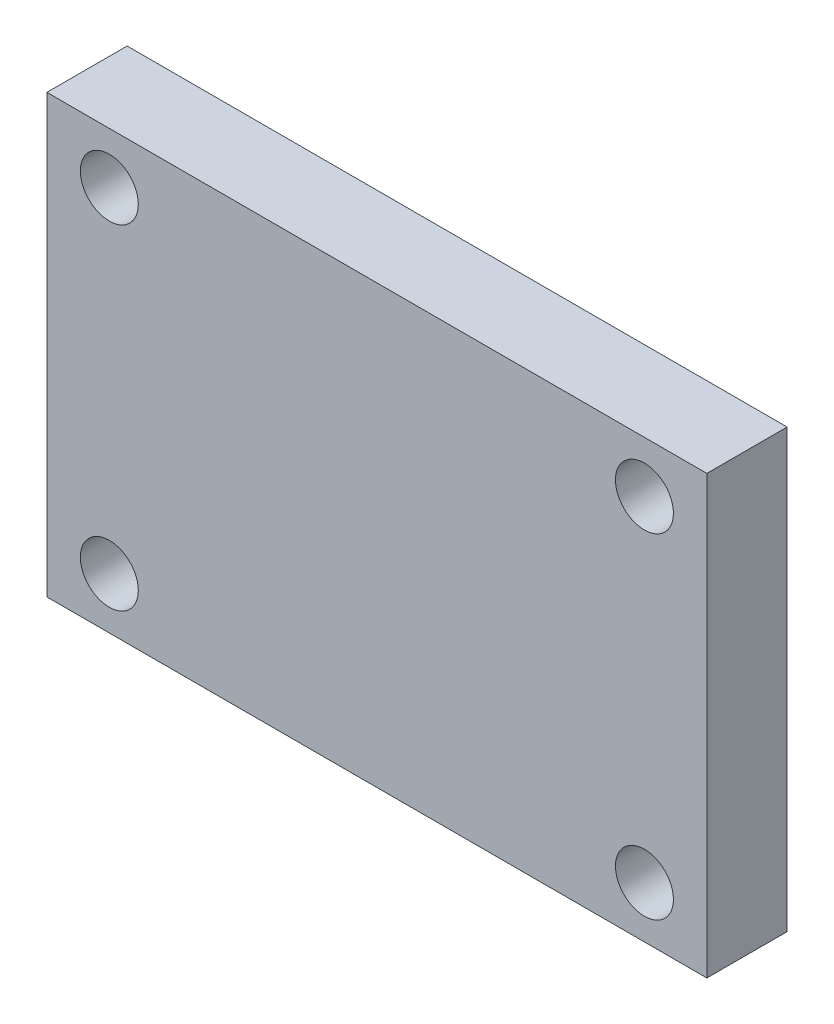
from build123d import *

# Parameters (mm, degrees)
SKETCH1_W      = 296
SKETCH1_H      = 196
SKETCH1_R      = 13
EXTRUDE1_DEPTH = 36


with BuildPart() as part:
    # Sketch1 → Extrude1 (new body)
    with BuildSketch(Plane.XY):
        Rectangle(SKETCH1_W, SKETCH1_H)
        with Locations((-120, 75)):
            Circle(SKETCH1_R, mode=Mode.SUBTRACT)
        with Locations((-120, -75)):
            Circle(SKETCH1_R, mode=Mode.SUBTRACT)
        with Locations((120, 75)):
            Circle(SKETCH1_R, mode=Mode.SUBTRACT)
        with Locations((120, -75)):
            Circle(SKETCH1_R, mode=Mode.SUBTRACT)
    extrude(amount=-EXTRUDE1_DEPTH)


solid = part.part
